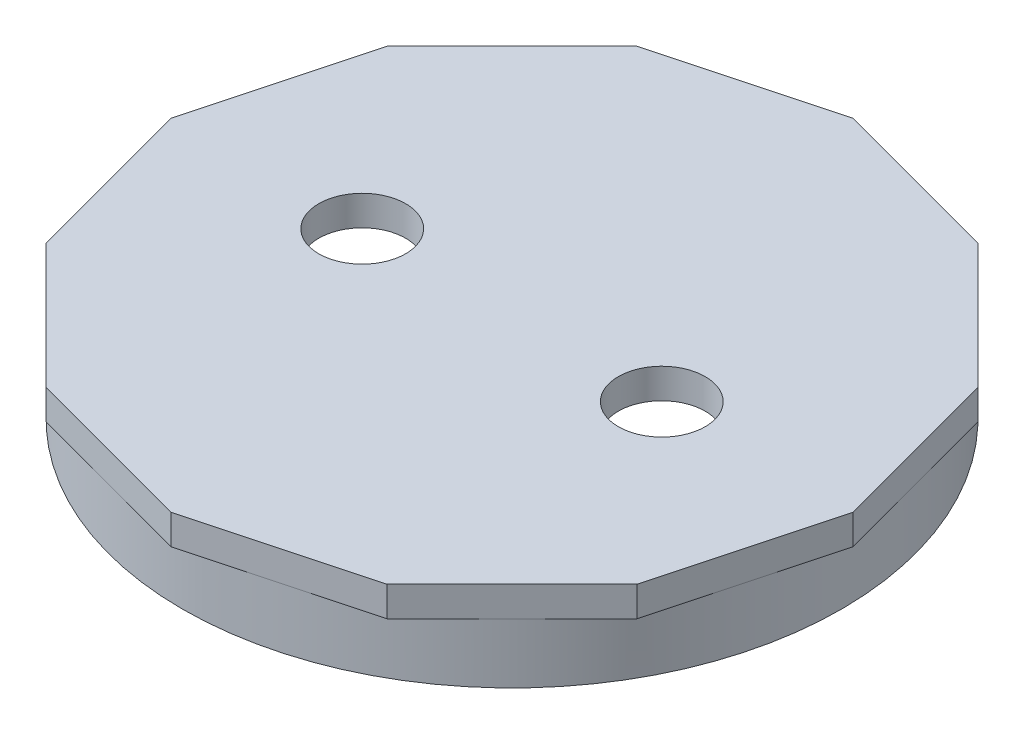
from build123d import *

# Parameters (mm, degrees)
SKETCH1_R           = 55
SKETCH1_R_2         = 50
BOSS_EXTRUDE1_DEPTH = 10
CUT_SWEEP1_PITCH    = 2
SKETCH4_R           = 55
BOSS_EXTRUDE2_DEPTH = 5
SKETCH5_R           = 54
BOSS_EXTRUDE3_DEPTH = 5
SKETCH6_R           = 7.25
CUT_EXTRUDE1_DEPTH  = 10


with BuildPart() as part:
    # Sketch1 → Boss-Extrude1 (new body)
    with BuildSketch(Plane(origin=(0, 0, 0), x_dir=(1, 0, 0), z_dir=(0, 1, 0))):
        with Locations(Location((0, 0, 0), (0, 0, 270))):
            Circle(SKETCH1_R)
        with Locations(Location((0, 0, 0), (0, 0, 270))):
            Circle(SKETCH1_R_2, mode=Mode.SUBTRACT)
    extrude(amount=BOSS_EXTRUDE1_DEPTH)

    # Cut-Sweep1: arcs per turn and ends read off the stored shape
    # Cut-Sweep1: the profile of Sketch3 screwed along a right-hand helix through 7 turns, 10 arcs to a turn; built about Z, then put on its axis
    cut_sweep1_z = Axis((0, 0, 0), (0, 0, 1))
    cut_sweep1_corners = [(51.499993663, 0, -1.999840012), (49.249993663, 0, -3.298878117), (49.249993663, 0, -0.700801906)]
    with BuildLine(mode=Mode.PRIVATE) as cut_sweep1_profile:
        Line(cut_sweep1_corners[0], cut_sweep1_corners[1])
        Line(cut_sweep1_corners[1], cut_sweep1_corners[2])
        Line(cut_sweep1_corners[2], cut_sweep1_corners[0])
    cut_sweep1_cap = Face(cut_sweep1_profile.wire())
    cut_sweep1_turn_angles = [0, 18, 36, 54, 72, 90, 108, 126, 144, 162, 180, 198, 216, 234, 252, 270, 288, 306, 324, 342, 360]
    cut_sweep1_turn_weights = [1, 0.9510565162951535, 1, 0.9510565162951535, 1, 0.9510565162951535, 1, 0.9510565162951535, 1, 0.9510565162951535, 1, 0.9510565162951535, 1, 0.9510565162951535, 1, 0.9510565162951535, 1, 0.9510565162951535, 1, 0.9510565162951535, 1]
    cut_sweep1_turn_rails = [Edge.make_bspline([Vector(p[0], p[1], 0).rotate(cut_sweep1_z, cut_sweep1_turn_angles[k]) / cut_sweep1_turn_weights[k] + Vector(0, 0, p[2] + CUT_SWEEP1_PITCH * cut_sweep1_turn_angles[k] / 360) for k in range(21)], [0, 0, 0, 1, 1, 2, 2, 3, 3, 4, 4, 5, 5, 6, 6, 7, 7, 8, 8, 9, 9, 10, 10, 10], 2, cut_sweep1_turn_weights) for p in cut_sweep1_corners]
    cut_sweep1_turn_sides = [Face.make_surface_from_curves(cut_sweep1_turn_rails[p[0]], cut_sweep1_turn_rails[p[1]]) for p in [(0, 1), (1, 2), (2, 0)]]
    cut_sweep1 = Plane(origin=(0, 10, 0), x_dir=(-1, 0, 0), z_dir=(0, -1, 0)) * Solid(Shell([*[p.moved(Location((0, 0, CUT_SWEEP1_PITCH * i))) for i in range(7) for p in cut_sweep1_turn_sides], cut_sweep1_cap, cut_sweep1_cap.rotate(cut_sweep1_z, 2520).moved(Location((0, 0, CUT_SWEEP1_PITCH * 2520 / 360)))]))
    add(cut_sweep1, mode=Mode.SUBTRACT)

    # Sketch4 → Boss-Extrude2 (add)
    with BuildSketch(Plane(origin=(0, 10, 0), x_dir=(1, 0, 0), z_dir=(0, 1, 0))):
        with Locations(Location((0, 0, 0), (0, 0, 270))):
            Circle(SKETCH4_R)
    extrude(amount=BOSS_EXTRUDE2_DEPTH)

    # Sketch5 → Boss-Extrude3 (add)
    with BuildSketch(Plane(origin=(0, 15, 0), x_dir=(1, 0, 0), z_dir=(0, 1, 0))):
        Polygon((56.940189923, 0), (49.311650969, 28.470094961), (28.470094961, 49.311650969), (0, 56.940189923), (-28.470094961, 49.311650969), (-49.311650969, 28.470094961), (-56.940189923, 0), (-49.311650969, -28.470094961), (-28.470094961, -49.311650969), (0, -56.940189923), (28.470094961, -49.311650969), (49.311650969, -28.470094961), align=None)
        Circle(SKETCH5_R, mode=Mode.SUBTRACT)
    extrude(amount=-BOSS_EXTRUDE3_DEPTH)

    # Sketch6 → Cut-Extrude1 (cut)
    with BuildSketch(Plane(origin=(0, 15, 0), x_dir=(1, 0, 0), z_dir=(0, 1, 0))):
        with Locations(Location((-25, 0, 0), (0, 0, 270))):
            Circle(SKETCH6_R)
        with Locations(Location((25, 0, 0), (0, 0, 270))):
            Circle(SKETCH6_R)
    extrude(amount=-CUT_EXTRUDE1_DEPTH, mode=Mode.SUBTRACT)


solid = part.part
